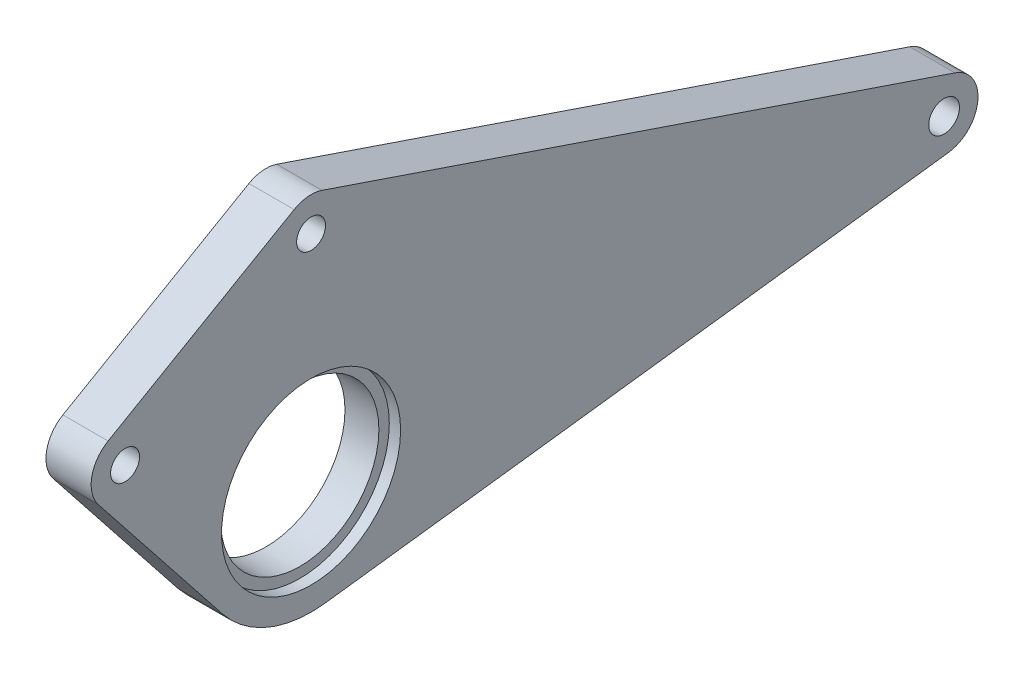
from build123d import *

# Parameters (mm, degrees)
SKETCH1_R           = 2.159
SKETCH1_R_2         = 11.1125
SKETCH1_R_3         = 2.032
BOSS_EXTRUDE1_DEPTH = 6.35
SKETCH2_R           = 12.573
CUT_EXTRUDE1_DEPTH  = 1.5875


with BuildPart() as part:
    # Sketch1 → Boss-Extrude1 (new body)
    with BuildSketch(Plane(origin=(0, 0, 0), x_dir=(0, 0, -1), z_dir=(1, 0, 0))):
        with BuildLine():
            Line((1.530173842, 4.50998606), (-87.369826158, 34.67248606))
            ThreePointArc((-87.369826158, 34.67248606), (-89.367164793, 34.902031971), (-91.28125, 34.286945986))
            Line((-91.28125, 34.286945986), (-117.402741242, 19.205695986))
            ThreePointArc((-117.402741242, 19.205695986), (-119.699491914, 15.974399462), (-118.754774559, 12.124224142))
            Line((-118.754774559, 12.124224142), (-101.344277724, -9.85675286))
            ThreePointArc((-101.344277724, -9.85675286), (-94.903034277, -14.696230961), (-86.915625, -15.750488274))
            Line((-86.915625, -15.750488274), (0.5953125, -4.725146482))
            ThreePointArc((0.5953125, -4.725146482), (4.738284639, -0.479650846), (1.530173842, 4.50998606))
        make_face()
        Circle(SKETCH1_R, mode=Mode.SUBTRACT)
        with Locations((-88.9, 0)):
            Circle(SKETCH1_R_2, mode=Mode.SUBTRACT)
        with Locations((-88.9, 30.1625)):
            Circle(SKETCH1_R_3, mode=Mode.SUBTRACT)
        with Locations((-115.021491242, 15.08125)):
            Circle(SKETCH1_R_3, mode=Mode.SUBTRACT)
    extrude(amount=BOSS_EXTRUDE1_DEPTH)

    # Sketch2 → Cut-Extrude1 (cut)
    with BuildSketch(Plane(origin=(6.35, 0, 0), x_dir=(0, 0, -1), z_dir=(1, 0, 0))):
        with Locations((-88.9, 0)):
            Circle(SKETCH2_R)
    extrude(amount=-CUT_EXTRUDE1_DEPTH, mode=Mode.SUBTRACT)


solid = part.part
